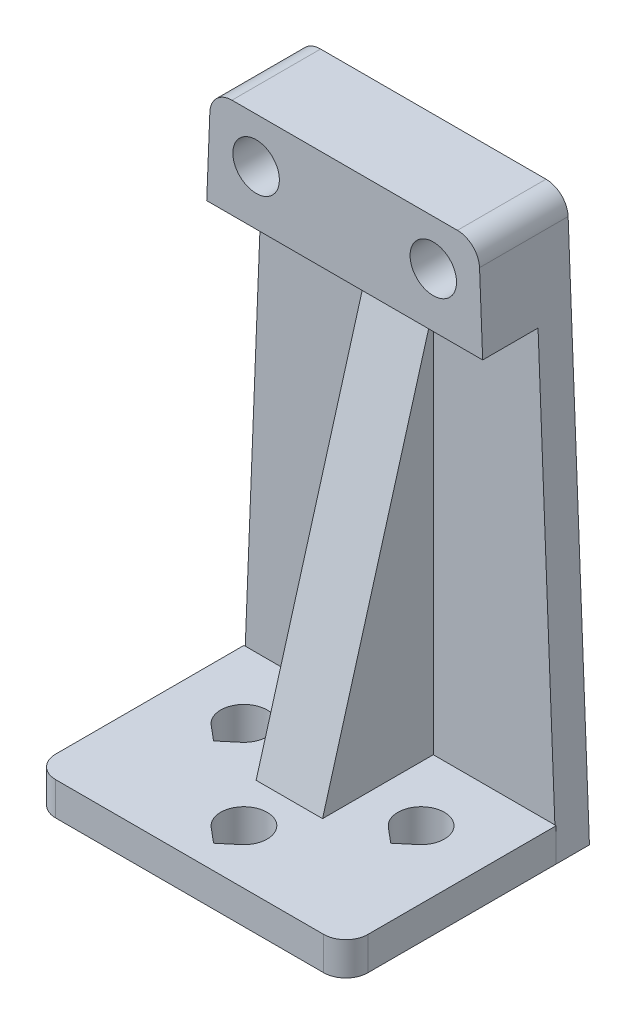
from build123d import *

# Parameters (mm, degrees)
SKETCH1_W           = 28.2
SKETCH1_H           = 19
BOSS_EXTRUDE1_DEPTH = 3
SKETCH2_R           = 2.1
BOSS_EXTRUDE2_DEPTH = 3
BOSS_EXTRUDE3_DEPTH = 3
FILLET1_R           = 2
SKETCH4_R           = 2.1
BOSS_EXTRUDE4_DEPTH = 5


with BuildPart() as part:
    # Sketch1 → Boss-Extrude1 (new body)
    with BuildSketch(Plane(origin=(0, 0, 0), x_dir=(1, 0, 0), z_dir=(0, 1, 0))):
        with Locations((0, -9.5)):
            Rectangle(SKETCH1_W, SKETCH1_H)
        with BuildLine():
            Line((-9.34985398, -7.708693331), (-8, -8.841355308))
            Line((-8, -8.841355308), (-6.65014602, -7.708693331))
            ThreePointArc((-6.65014602, -7.708693331), (-8, -4), (-9.34985398, -7.708693331))
        make_face(mode=Mode.SUBTRACT)
        with BuildLine():
            Line((-1.34985398, -15.708693331), (0, -16.841355308))
            Line((0, -16.841355308), (1.34985398, -15.708693331))
            ThreePointArc((1.34985398, -15.708693331), (0, -12), (-1.34985398, -15.708693331))
        make_face(mode=Mode.SUBTRACT)
        with BuildLine():
            Line((6.65014602, -7.708693331), (8, -8.841355308))
            Line((8, -8.841355308), (9.34985398, -7.708693331))
            ThreePointArc((9.34985398, -7.708693331), (8, -4), (6.65014602, -7.708693331))
        make_face(mode=Mode.SUBTRACT)
    extrude(amount=BOSS_EXTRUDE1_DEPTH)

    # Sketch2 → Boss-Extrude2 (add)
    with BuildSketch(Plane(origin=(0, 0, 0), x_dir=(-1, 0, 0), z_dir=(0, 0, -1))):
        Polygon((-14.1, 0), (14.1, 0), (12.1, 50.1), (-12.1, 50.1), align=None)
        with Locations((-8, 46)):
            Circle(SKETCH2_R, mode=Mode.SUBTRACT)
        with Locations((8, 46)):
            Circle(SKETCH2_R, mode=Mode.SUBTRACT)
    extrude(amount=BOSS_EXTRUDE2_DEPTH)

    # Sketch3 → Boss-Extrude3 (add, symmetric)
    with BuildSketch(Plane(origin=(0, 0, 0), x_dir=(0, 0, -1), z_dir=(1, 0, 0))):
        Polygon((0, 3), (-10, 3), (0, 38), align=None)
    extrude(amount=BOSS_EXTRUDE3_DEPTH, both=True)

    # Fillet1
    fillet1_edges = [part.edges().sort_by_distance(p)[0] for p in [
        (12.1, 50.1, -1.5),
        (-12.1, 50.1, -1.5),
        (14.1, 1.5, 19),
        (-14.1, 1.5, 19),
    ]]
    fillet(fillet1_edges, radius=FILLET1_R)

    # Sketch4 → Boss-Extrude4 (add)
    with BuildSketch(Plane.XY):
        with BuildLine():
            Line((-10.178247335, 50.1), (10.178247335, 50.1))
            ThreePointArc((10.178247335, 50.1), (11.563968527, 49.54214312), (12.176655618, 48.179776778))
            Line((12.176655618, 48.179776778), (12.459281437, 41.1))
            Line((12.459281437, 41.1), (-12.459281437, 41.1))
            Line((-12.459281437, 41.1), (-12.176655618, 48.179776778))
            ThreePointArc((-12.176655618, 48.179776778), (-11.563968527, 49.54214312), (-10.178247335, 50.1))
        make_face()
        with Locations((-8, 46)):
            Circle(SKETCH4_R, mode=Mode.SUBTRACT)
        with Locations((8, 46)):
            Circle(SKETCH4_R, mode=Mode.SUBTRACT)
    extrude(amount=BOSS_EXTRUDE4_DEPTH)


solid = part.part
